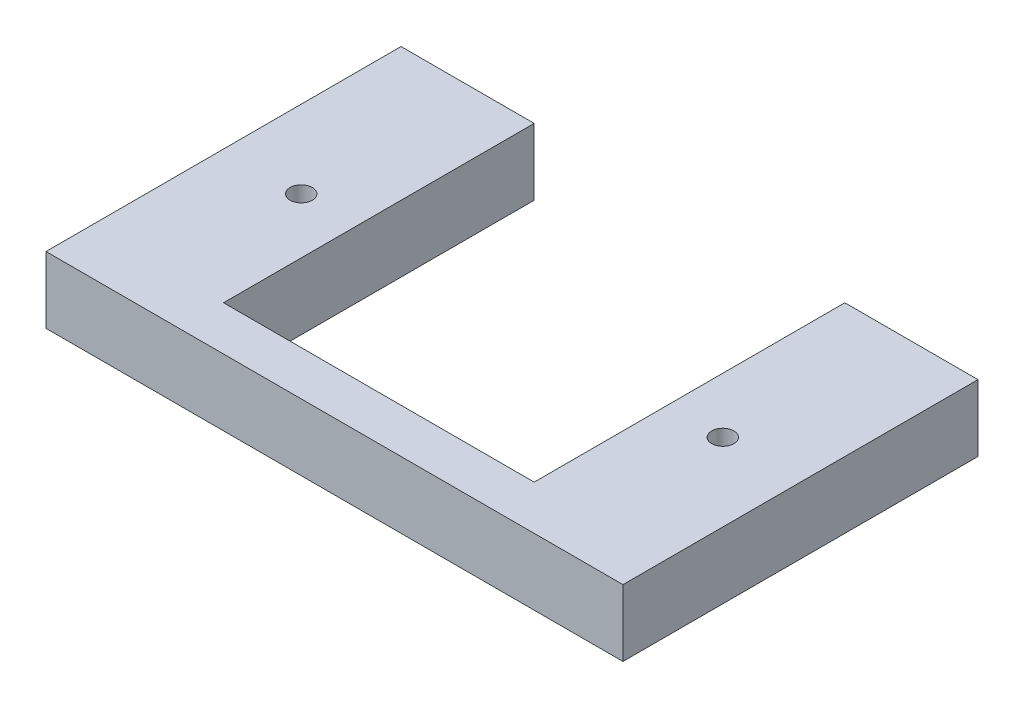
from build123d import *

# Parameters (mm, degrees)
SKETCH1_W           = 165.1
SKETCH1_H           = 101.6
BOSS_EXTRUDE1_DEPTH = 19.05
SKETCH2_W           = 88.9
SKETCH2_H           = 88.9
CUT_EXTRUDE1_DEPTH  = 99.782817332
SKETCH3_R           = 3.175
CUT_EXTRUDE2_DEPTH  = 15.875


with BuildPart() as part:
    # Sketch1 → Boss-Extrude1 (new body)
    with BuildSketch(Plane(origin=(0, 0, 0), x_dir=(1, 0, 0), z_dir=(0, 1, 0))):
        Rectangle(SKETCH1_W, SKETCH1_H)
    extrude(amount=BOSS_EXTRUDE1_DEPTH)

    # Sketch2 → Cut-Extrude1 (cut, through all)
    with BuildSketch(Plane(origin=(0, 19.05, 0), x_dir=(1, 0, 0), z_dir=(0, 1, 0))):
        with Locations((0, 6.35)):
            Rectangle(SKETCH2_W, SKETCH2_H)
    extrude(amount=-CUT_EXTRUDE1_DEPTH, mode=Mode.SUBTRACT)

    # Sketch3 → Cut-Extrude2 (cut)
    with BuildSketch(Plane(origin=(0, 19.05, 0), x_dir=(1, 0, 0), z_dir=(0, 1, 0))):
        with Locations((-60.325, 0)):
            Circle(SKETCH3_R)
        with Locations((60.325, 0)):
            Circle(SKETCH3_R)
    extrude(amount=-CUT_EXTRUDE2_DEPTH, mode=Mode.SUBTRACT)


solid = part.part
